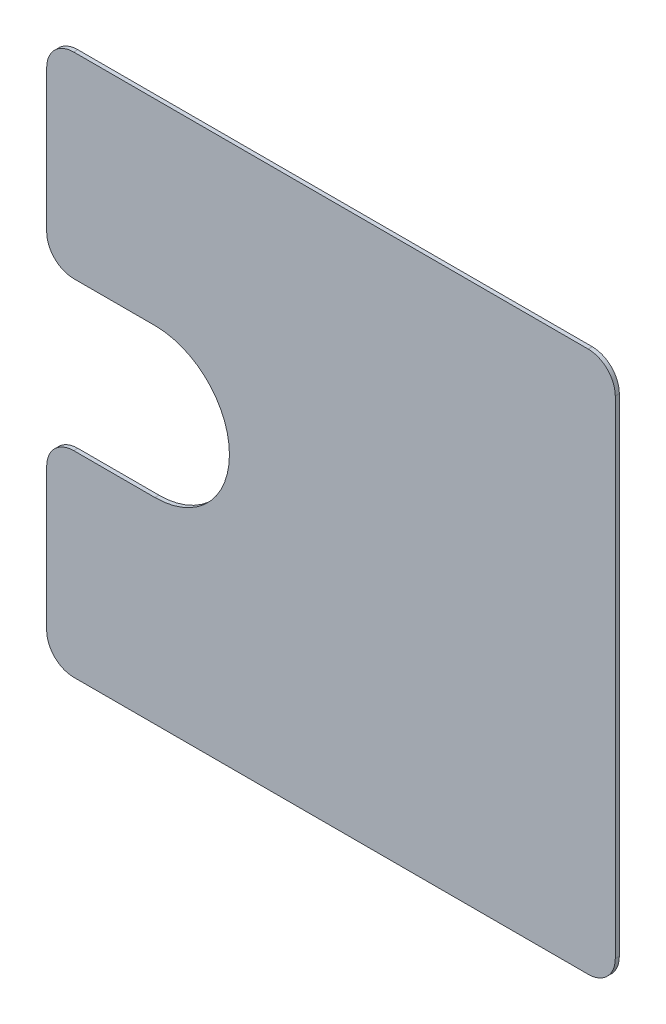
from build123d import *

# Parameters (mm, degrees)
EXTRUDE_1_DEPTH = 3
FILLET_1_R      = 20


with BuildPart() as part:
    # 草图1 → 凸台-拉伸1 (new body)
    with BuildSketch(Plane.XY):
        with BuildLine():
            Line((-130, 55), (-210, 55))
            Line((-210, 55), (-210, 180))
            ThreePointArc((-210, 180), (-204.142135624, 194.142135624), (-190, 200))
            Line((-190, 200), (190, 200))
            ThreePointArc((190, 200), (204.142135624, 194.142135624), (210, 180))
            Line((210, 180), (210, -180))
            ThreePointArc((210, -180), (204.142135624, -194.142135624), (190, -200))
            Line((190, -200), (-190, -200))
            ThreePointArc((-190, -200), (-204.142135624, -194.142135624), (-210, -180))
            Line((-210, -180), (-210, -55))
            Line((-210, -55), (-130, -55))
            ThreePointArc((-130, -55), (-75, 0), (-130, 55))
        make_face()
    extrude(amount=EXTRUDE_1_DEPTH)

    # 圆角1
    fillet_1_edges = [part.edges().sort_by_distance(p)[0] for p in [
        (-210, -55, 1.5),
        (-210, 55, 1.5),
    ]]
    fillet(fillet_1_edges, radius=FILLET_1_R)


solid = part.part
